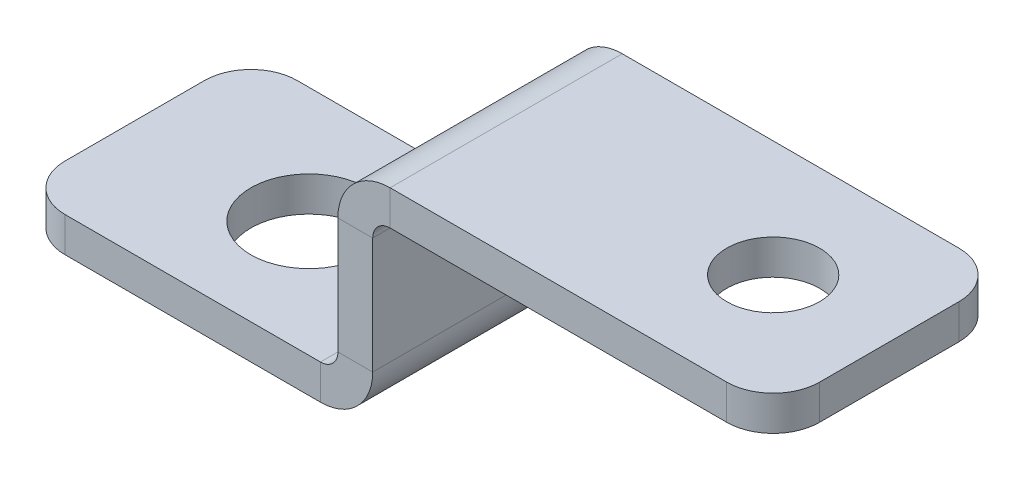
from build123d import *

# Parameters (mm, degrees)
BASE_FLANGE1_DEPTH = 10
SKETCH6_R          = 2.5
CUT_EXTRUDE1_DEPTH = 35.932076949
SKETCH7_R          = 2
CUT_EXTRUDE2_DEPTH = 36.305806888
FILLET1_R          = 2


# Sheet-metal steps are written as plain solids
with BuildPart() as part:
    # Sketch1 → Base-Flange1 (new body)
    with BuildSketch(Plane.XY):
        with BuildLine():
            Line((0, 0), (13, 0))
            ThreePointArc((13, 0), (13.530330086, 0.219669914), (13.75, 0.75))
            Line((13.75, 0.75), (13.75, 5.75))
            ThreePointArc((13.75, 5.75), (14.409009742, 7.340990258), (16, 8))
            Line((16, 8), (32.5, 8))
            Line((32.5, 8), (32.5, 6.5))
            Line((32.5, 6.5), (16, 6.5))
            ThreePointArc((16, 6.5), (15.469669914, 6.280330086), (15.25, 5.75))
            Line((15.25, 5.75), (15.25, 0.75))
            ThreePointArc((15.25, 0.75), (14.590990258, -0.840990258), (13, -1.5))
            Line((13, -1.5), (0, -1.5))
            Line((0, -1.5), (0, 0))
        make_face()
    extrude(amount=BASE_FLANGE1_DEPTH)

    # Sketch6 → Cut-Extrude1 (cut, through all)
    with BuildSketch(Plane(origin=(0, 0, 0), x_dir=(1, 0, 0), z_dir=(0, 1, 0))):
        with Locations(Location((7.5, -5, 0), (0, 0, 270))):
            Circle(SKETCH6_R)
    extrude(amount=-CUT_EXTRUDE1_DEPTH, mode=Mode.SUBTRACT)

    # Sketch7 → Cut-Extrude2 (cut, through all)
    with BuildSketch(Plane(origin=(0, 8, 0), x_dir=(1, 0, 0), z_dir=(0, 1, 0))):
        with Locations(Location((27.5, -5, 0), (0, 0, 270))):
            Circle(SKETCH7_R)
    extrude(amount=-CUT_EXTRUDE2_DEPTH, mode=Mode.SUBTRACT)

    # Fillet1
    fillet1_edges = [part.edges().sort_by_distance(p)[0] for p in [
        (0, -0.75, 0),
        (32.5, 7.25, 0),
        (0, -0.75, 10),
        (32.5, 7.25, 10),
    ]]
    fillet(fillet1_edges, radius=FILLET1_R)


solid = part.part
